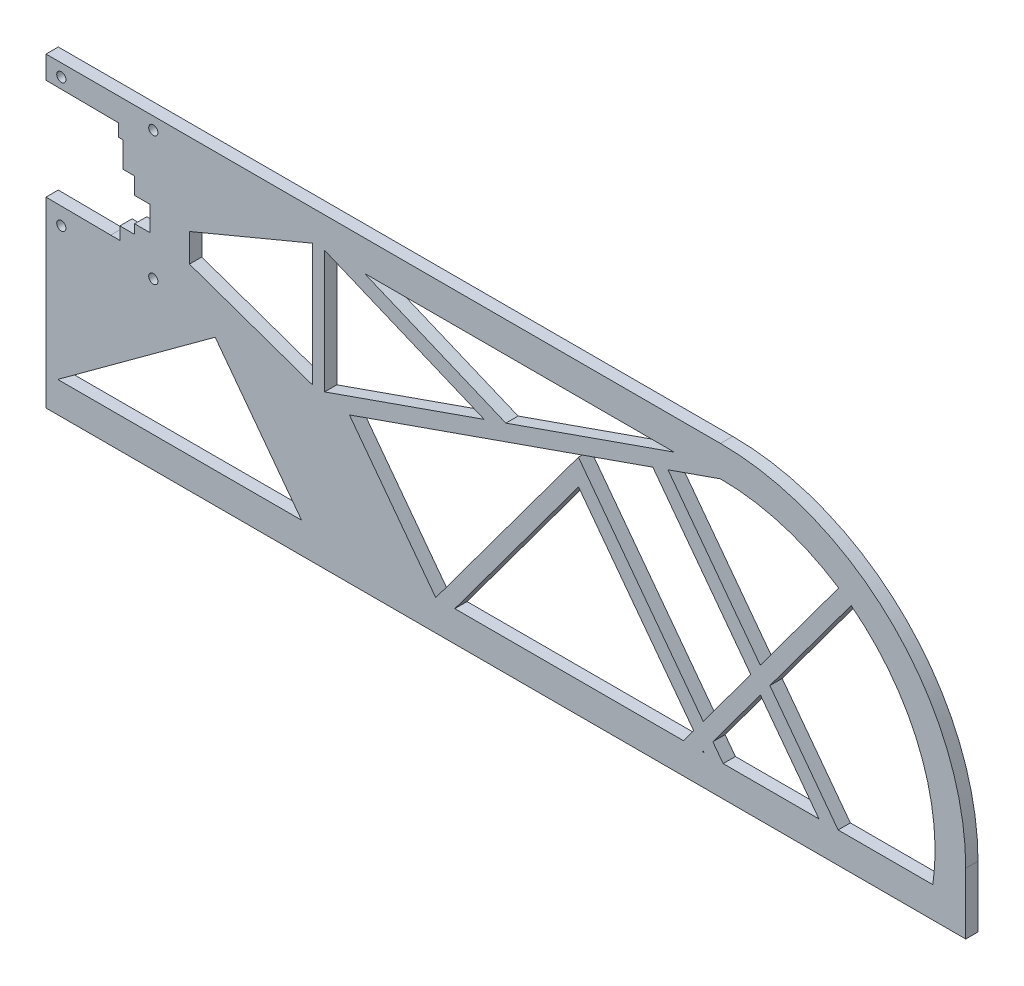
from build123d import *

# Parameters (mm, degrees)
EXTRUDE_1_DEPTH          = 4
CUT_EXTRUDE_1_DEPTH      = 159.164471358
CUT_EXTRUDE_2_DEPTH      = 159.126531613
CUT_EXTRUDE_2_DEPTH_BACK = 159.126531613
SKETCH_7_R               = 1.5


with BuildPart() as part:
    # 草图1 → 凸台-拉伸1 (new body)
    with BuildSketch(Plane.XY):
        with BuildLine():
            Line((70, 50), (-150, 50))
            Line((-150, 50), (-150, -50))
            Line((-150, -50), (150, -50))
            Line((150, -50), (150, -30))
            ThreePointArc((150, -30), (126.568542495, 26.568542495), (70, 50))
        make_face()
    extrude(amount=EXTRUDE_1_DEPTH)

    # 草图4 → 切除-拉伸1 (cut, through all)
    with BuildSketch(Plane.XY.offset(4)):
        Polygon((-126.411313313, 42.4), (-128.916408127, 42.4), (-150, 42.591669017), (-150, 9.591669017), (-128.916408127, 9.4), (-125.910386826, 9.4), (-125.910386826, 13.5), (-121.102737566, 13.5), (-121.102737566, 16.5), (-116.096591045, 16.5), (-116.096591045, 24.5), (-121.102737566, 24.5), (-121.102737566, 30), (-124.908615458, 30), (-124.908615458, 38.3), (-126.411313313, 38.3), align=None)
    extrude(amount=-CUT_EXTRUDE_1_DEPTH, mode=Mode.SUBTRACT)

    # 草图7 → 切除-拉伸2 (cut, two sides: drawn at the far end of the back side and taken through both)
    with BuildSketch(Plane.XY.offset(2).offset(-CUT_EXTRUDE_2_DEPTH_BACK)):
        Polygon((-51.03072045, -2.459143698), (-22.875078223, -40), (23.663766898, 22.948206506), (64.371301266, -31.328505985), (79.884249639, -10.345770483), (47.931387908, 32.258045159), align=None)
        Polygon((-59.125078223, 40), (-59.125078223, 0), (-7.054816939, 18.266921803), align=None)
        Polygon((-103.195339507, 14.057166441), (-63.125078223, 0), (-63.125078223, 40), (-103.195339507, 23.275480084), align=None)
        Polygon((54.895799176, 40), (-46.144003315, 40), (-0.001849037, 20.741194256), align=None)
        Polygon((-66.625513106, -40), (-94.821416434, -2.405462229), (-146.172731227, -40), align=None)
        Polygon((23.692526021, 14.576527676), (-16.656972554, -40), (57.960295467, -40), (61.268711591, -35.525053085), align=None)
        with BuildLine():
            ThreePointArc((108.550590863, 28.428177655), (90.124954213, 37.044658385), (70, 40))
            Line((70, 40), (52.879493325, 33.993904602))
            Line((52.879493325, 33.993904602), (82.986839314, -6.149223383))
            Line((82.986839314, -6.149223383), (108.550590863, 28.428177655))
        make_face()
        Polygon((64.400060389, -39.700184815), (64.178401136, -40), (64.624921777, -40), align=None)
        with BuildLine():
            ThreePointArc((139.282032303, -40), (134.83949709, -3.621227908), (112.623646184, 25.526793406))
            Line((112.623646184, 25.526793406), (86.118188112, -10.324355113))
            Line((86.118188112, -10.324355113), (108.374921777, -40))
            Line((108.374921777, -40), (139.282032303, -40))
        make_face()
        with Locations((-115.003042664, 4)):
            Circle(SKETCH_7_R)
        Polygon((67.502650063, -35.503637715), (70.874921777, -40), (102.124921777, -40), (83.015598437, -14.520902213), align=None)
        with Locations((-145.003042664, 46)):
            Circle(SKETCH_7_R)
        with Locations((-115.003042664, 46)):
            Circle(SKETCH_7_R)
        with Locations((-145.003042664, 4)):
            Circle(SKETCH_7_R)
    extrude(amount=CUT_EXTRUDE_2_DEPTH + CUT_EXTRUDE_2_DEPTH_BACK, mode=Mode.SUBTRACT)


solid = part.part
